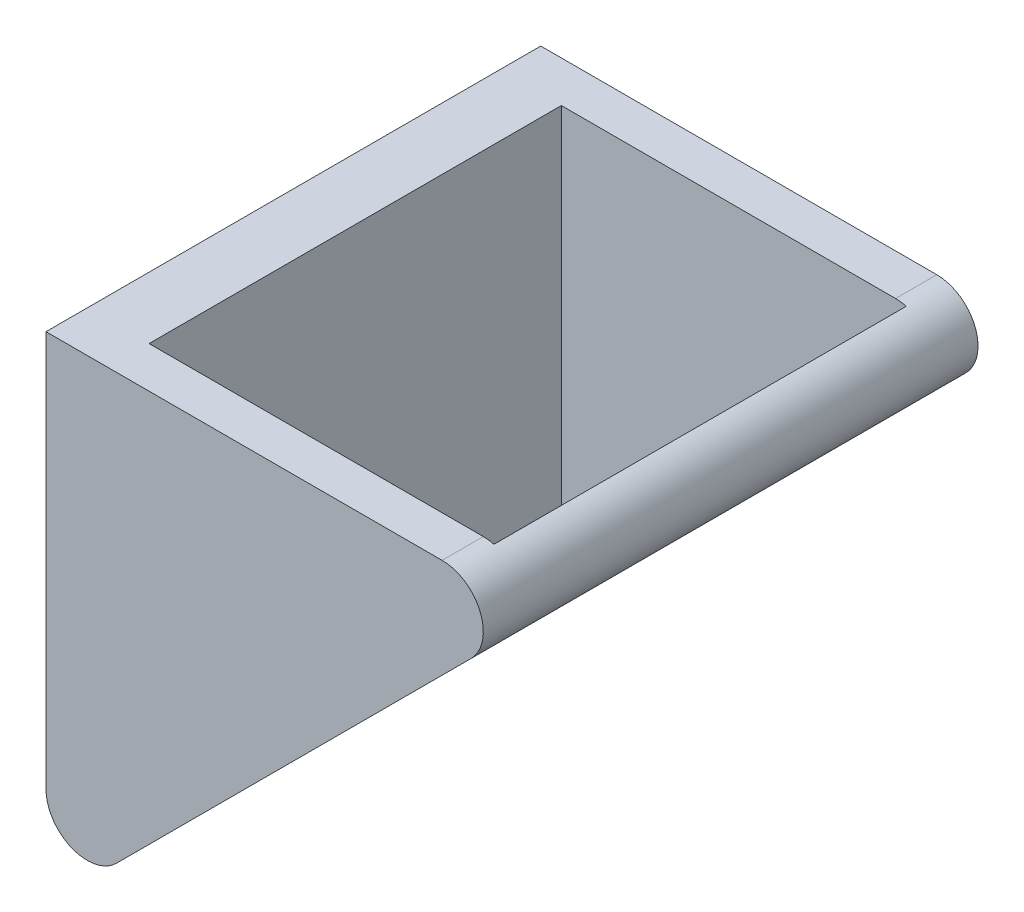
from build123d import *

# Parameters (mm, degrees)
BOSS_EXTRUDE1_DEPTH = 12
BOSS_EXTRUDE2_DEPTH = 1
BOSS_EXTRUDE3_DEPTH = 1
FILLET1_R           = 1
SKETCH5_W           = 5.5
SKETCH5_H           = 5.5
CUT_EXTRUDE1_DEPTH  = 15.422205102


with BuildPart() as part:
    # Sketch1 → Boss-Extrude1 (new body)
    with BuildSketch(Plane.XY):
        Polygon((1.5, 0), (0, 0), (0, -12.02081528), (12.02081528, 0), (9.899494937, 0), (8.399494937, -1.5), (1.5, -8.399494937), (1.5, -1.5), align=None)
    extrude(amount=BOSS_EXTRUDE1_DEPTH)

    # Sketch2 → Boss-Extrude2 (add)
    with BuildSketch(Plane.XY.offset(12)):
        Polygon((0, 0), (12.02081528, 0), (0, -12.02081528), align=None)
    extrude(amount=-BOSS_EXTRUDE2_DEPTH)

    # Sketch3 → Boss-Extrude3 (add)
    with BuildSketch(Plane(origin=(0, 0, 0), x_dir=(-1, 0, 0), z_dir=(0, 0, -1))):
        Polygon((-12.02081528, 0), (0, 0), (0, -12.02081528), align=None)
    extrude(amount=-BOSS_EXTRUDE3_DEPTH)

    # Fillet1
    # the kernel refuses this fillet: 1 mm, written as the material it takes off along each edge
    with BuildSketch(Plane(origin=(0, -12.02081528, -6.035533906), x_dir=(0, 1, 0), z_dir=(0, 0, 1)), Plane(origin=(12.02081528, 0, 18.035533906), x_dir=(-1, 0, 0), z_dir=(0, 0, -1))) as fillet1_piece_1:
        with BuildLine():
            CenterArc((FILLET1_R * 2.41421356237, -FILLET1_R), FILLET1_R, 90, 135)
            Line((FILLET1_R * 1.70710678119, -FILLET1_R * 1.70710678119), (0, 0))
            Line((0, 0), (FILLET1_R * 2.41421356237, 0))
        make_face()
    extrude(amount=24.071067812, mode=Mode.SUBTRACT)

    # Sketch5 → Cut-Extrude1 (cut, through all)
    with BuildSketch(Plane(origin=(4.949747468, -4.949747468, 0), x_dir=(0, 0, 1), z_dir=(-0.7071067811865476, 0.7071067811865475, 0))):
        with Locations((6, 1.036566092)):
            Rectangle(SKETCH5_W, SKETCH5_H)
    extrude(amount=-CUT_EXTRUDE1_DEPTH, mode=Mode.SUBTRACT)


solid = part.part
